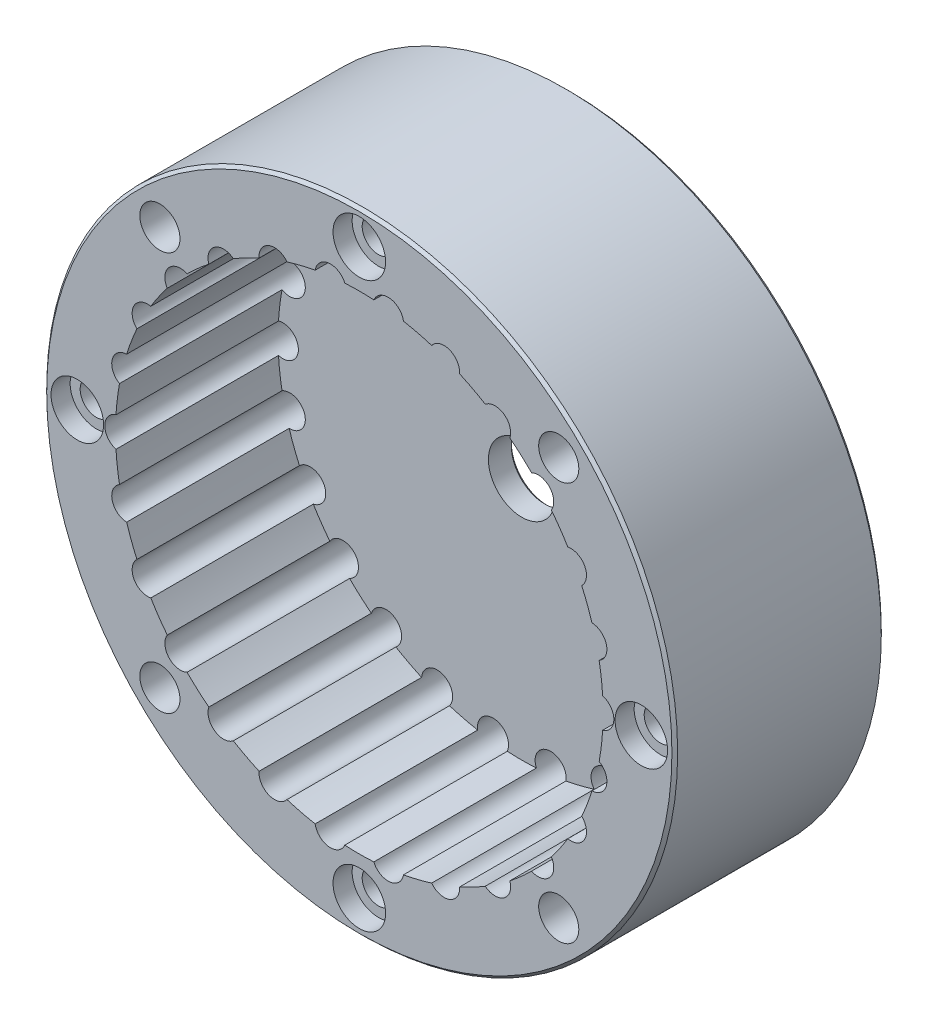
from build123d import *

# Parameters (mm, degrees)
SKETCH1_R               = 33
SKETCH1_R_2             = 25.5
BOSS_EXTRUDE2_DEPTH     = 17
BOSS_EXTRUDE3_START     = -5
SKETCH1_3_R             = 33
BOSS_EXTRUDE3_DEPTH     = 5
CUT_EXTRUDE4_DEPTH      = 50.668903753
CUT_EXTRUDE4_DEPTH_BACK = 3
SKETCH1_5_R             = 1.625
CUT_EXTRUDE6_DEPTH      = 50.668903753
CUT_EXTRUDE6_DEPTH_BACK = 50.668903753
SKETCH3_R               = 1.7
SKETCH3_R_2             = 3.5
SKETCH4_R               = 10
CUT_EXTRUDE7_DEPTH      = 2.3
SKETCH6_R               = 2.1
CUT_EXTRUDE8_DEPTH      = 10
SKETCH7_R               = 2.75
CUT_EXTRUDE9_DEPTH      = 2
CHAMFER1_SIZE           = 0.4
CHAMFER2_SIZE           = 0.3
CHAMFER3_SIZE           = 0.4
CHAMFER4_SIZE           = 0.3


with BuildPart() as part:
    # Sketch1 → Boss-Extrude2 (new body)
    with BuildSketch(Plane.XY):
        Circle(SKETCH1_R)
        Circle(SKETCH1_R_2, mode=Mode.SUBTRACT)
    extrude(amount=BOSS_EXTRUDE2_DEPTH)

    # Sketch1<3> → Boss-Extrude3 (add)
    with BuildSketch(Plane.XY.offset(BOSS_EXTRUDE3_START)):
        Circle(SKETCH1_3_R)
    extrude(amount=BOSS_EXTRUDE3_DEPTH)

    # Sketch1<5> → Cut-Extrude4 (cut, two sides: drawn at the far end of the back side and taken through both)
    with BuildSketch(Plane.XY.offset(-CUT_EXTRUDE4_DEPTH_BACK)):
        with Locations((25, 0)):
            Circle(SKETCH1_5_R)
        with Locations((24.273545436, -5.982891607)):
            Circle(SKETCH1_5_R)
        with Locations((22.136400641, -11.618079301)):
            Circle(SKETCH1_5_R)
        with Locations((18.712768704, -16.578066456)):
            Circle(SKETCH1_5_R)
        with Locations((14.201618668, -20.574596647)):
            Circle(SKETCH1_5_R)
        with Locations((8.865122176, -23.375406067)):
            Circle(SKETCH1_5_R)
        with Locations((3.013417006, -24.817721852)):
            Circle(SKETCH1_5_R)
        with Locations((-3.013417006, -24.817721852)):
            Circle(SKETCH1_5_R)
        with Locations((-8.865122176, -23.375406067)):
            Circle(SKETCH1_5_R)
        with Locations((-14.201618668, -20.574596647)):
            Circle(SKETCH1_5_R)
        with Locations((-18.712768704, -16.578066456)):
            Circle(SKETCH1_5_R)
        with Locations((-22.136400641, -11.618079301)):
            Circle(SKETCH1_5_R)
        with Locations((-24.273545436, -5.982891607)):
            Circle(SKETCH1_5_R)
        with Locations((-25, 0)):
            Circle(SKETCH1_5_R)
        with Locations((-24.273545436, 5.982891607)):
            Circle(SKETCH1_5_R)
        with Locations((-22.136400641, 11.618079301)):
            Circle(SKETCH1_5_R)
        with Locations((-18.712768704, 16.578066456)):
            Circle(SKETCH1_5_R)
        with Locations((-14.201618668, 20.574596647)):
            Circle(SKETCH1_5_R)
        with Locations((-8.865122176, 23.375406067)):
            Circle(SKETCH1_5_R)
        with Locations((-3.013417006, 24.817721852)):
            Circle(SKETCH1_5_R)
        with Locations((3.013417006, 24.817721852)):
            Circle(SKETCH1_5_R)
        with Locations((8.865122176, 23.375406067)):
            Circle(SKETCH1_5_R)
        with Locations((14.201618668, 20.574596647)):
            Circle(SKETCH1_5_R)
        with Locations((18.712768704, 16.578066456)):
            Circle(SKETCH1_5_R)
        with Locations((22.136400641, 11.618079301)):
            Circle(SKETCH1_5_R)
        with Locations((24.273545436, 5.982891607)):
            Circle(SKETCH1_5_R)
    extrude(amount=CUT_EXTRUDE4_DEPTH + CUT_EXTRUDE4_DEPTH_BACK, mode=Mode.SUBTRACT)

    # Sketch3 → Cut-Extrude6 (cut, two sides: drawn at the far end of the back side and taken through both)
    with BuildSketch(Plane.XY.offset(-CUT_EXTRUDE6_DEPTH_BACK)):
        with Locations((0, 29.5)):
            Circle(SKETCH3_R)
        with Locations((29.5, 0)):
            Circle(SKETCH3_R)
        with Locations((0, -29.5)):
            Circle(SKETCH3_R)
        with Locations((-29.5, 0)):
            Circle(SKETCH3_R)
        Circle(SKETCH3_R_2)
    extrude(amount=CUT_EXTRUDE6_DEPTH + CUT_EXTRUDE6_DEPTH_BACK, mode=Mode.SUBTRACT)

    # Sketch4 → Cut-Extrude7 (cut)
    with BuildSketch(Plane(origin=(0, 0, -5), x_dir=(-1, 0, 0), z_dir=(0, 0, -1))):
        Circle(SKETCH4_R)
    extrude(amount=-CUT_EXTRUDE7_DEPTH, mode=Mode.SUBTRACT)

    # Sketch6 → Cut-Extrude8 (cut)
    with BuildSketch(Plane.XY.offset(17)):
        with Locations((-20.859650045, 20.859650045)):
            Circle(SKETCH6_R)
        with Locations((20.859650045, 20.859650045)):
            Circle(SKETCH6_R)
        with Locations((20.859650045, -20.859650045)):
            Circle(SKETCH6_R)
        with Locations((-20.859650045, -20.859650045)):
            Circle(SKETCH6_R)
    extrude(amount=-CUT_EXTRUDE8_DEPTH, mode=Mode.SUBTRACT)

    # Sketch7 → Cut-Extrude9 (cut)
    with BuildSketch(Plane.XY.offset(17)):
        with Locations((0, 29.5)):
            Circle(SKETCH7_R)
        with Locations((29.5, 0)):
            Circle(SKETCH7_R)
        with Locations((0, -29.5)):
            Circle(SKETCH7_R)
        with Locations((-29.5, 0)):
            Circle(SKETCH7_R)
    extrude(amount=-CUT_EXTRUDE9_DEPTH, mode=Mode.SUBTRACT)

    # Chamfer1
    chamfer1_edges = [part.edges().sort_by_distance(p)[0] for p in [
        (10, 0, -5),
        (-1.7, -29.5, -5),
        (-31.2, 0, -5),
        (27.8, 0, -5),
        (-1.7, 29.5, -5),
    ]]
    chamfer(chamfer1_edges, length=CHAMFER1_SIZE)

    # Chamfer2
    chamfer2_edges = [part.edges().sort_by_distance(p)[0] for p in [
        (-3.5, 0, -2.7),
    ]]
    chamfer(chamfer2_edges, length=CHAMFER2_SIZE)

    # Chamfer3
    chamfer3_edges = [part.edges().sort_by_distance(p)[0] for p in [
        (-33, 0, -5),
    ]]
    chamfer(chamfer3_edges, length=CHAMFER3_SIZE)

    # Chamfer4
    chamfer4_edges = [part.edges().sort_by_distance(p)[0] for p in [
        (-33, 0, 17),
    ]]
    chamfer(chamfer4_edges, length=CHAMFER4_SIZE)


solid = part.part
